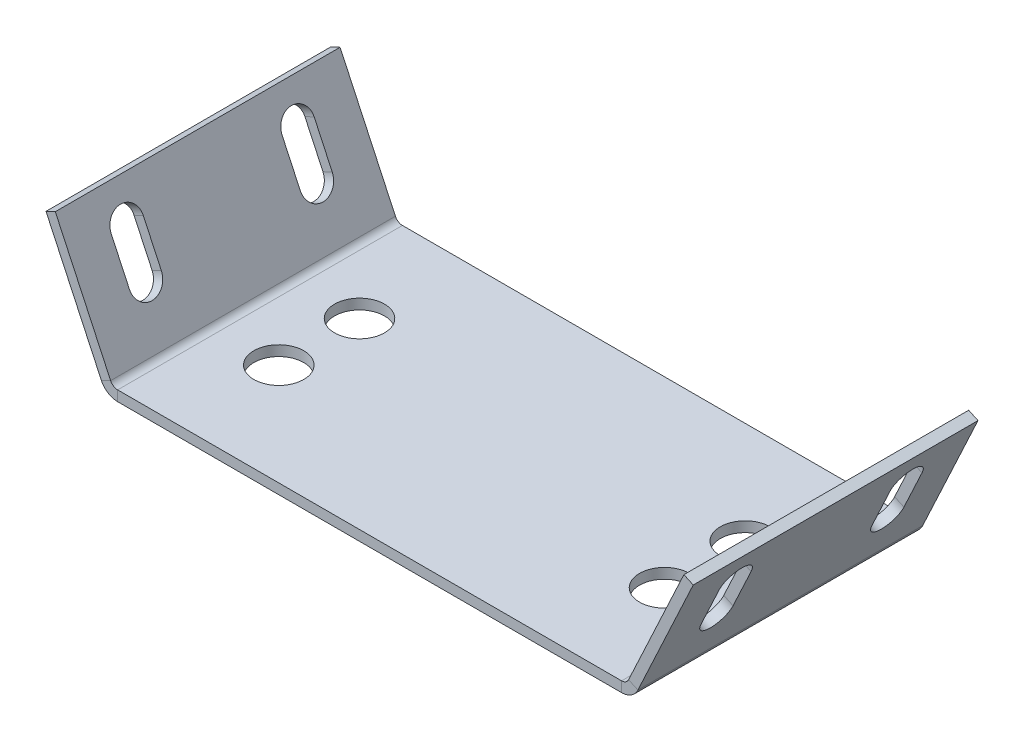
from build123d import *

# Parameters (mm, degrees)
BASE_FLANGE1_DEPTH = 31.75
CUT_EXTRUDE1_REACH = 86.256
SKETCH3_R          = 5.5626
CUT_EXTRUDE2_REACH = 137.032


# Sheet-metal steps are written as plain solids
with BuildPart() as part:
    # Sketch1 → Base-Flange1 (new, symmetric)
    with BuildSketch(Plane.XY):
        with BuildLine():
            Line((-72.15562981, 28.775272238), (-59.81800404, 2.317148392))
            ThreePointArc((-59.81800404, 2.317148392), (-58.337100418, 0.62850145), (-56.180809629, 0))
            Line((-56.180809629, 0), (56.180809629, 0))
            ThreePointArc((56.180809629, 0), (58.337100418, 0.62850145), (59.81800404, 2.317148392))
            Line((59.81800404, 2.317148392), (72.15562981, 28.775272238))
            Line((72.15562981, 28.775272238), (70.083810209, 29.741377585))
            Line((70.083810209, 29.741377585), (57.746184439, 3.283253738))
            ThreePointArc((57.746184439, 3.283253738), (57.108833513, 2.556494295), (56.180809629, 2.286))
            Line((56.180809629, 2.286), (-56.180809629, 2.286))
            ThreePointArc((-56.180809629, 2.286), (-57.108833513, 2.556494295), (-57.746184439, 3.283253738))
            Line((-57.746184439, 3.283253738), (-70.083810209, 29.741377585))
            Line((-70.083810209, 29.741377585), (-72.15562981, 28.775272238))
        make_face()
    extrude(amount=BASE_FLANGE1_DEPTH, both=True)

    # Sketch3 → Cut-Extrude1 (cut, up to next)
    with BuildSketch(Plane(origin=(0, 0, 0), x_dir=(1, 0, 0), z_dir=(0, 1, 0)), mode=Mode.PRIVATE) as cut_extrude1_sk1:
        with Locations(Location((43, 9, 0), (0, 0, 90))):
            Circle(SKETCH3_R)
    cut_extrude1_tool1 = extrude(cut_extrude1_sk1.sketch, amount=CUT_EXTRUDE1_REACH, mode=Mode.PRIVATE) & part.part
    # Sketch3 → Cut-Extrude1 (cut, up to next)
    with BuildSketch(Plane(origin=(0, 0, 0), x_dir=(1, 0, 0), z_dir=(0, 1, 0)), mode=Mode.PRIVATE) as cut_extrude1_sk2:
        with Locations(Location((43, -9, 0), (0, 0, 90))):
            Circle(SKETCH3_R)
    cut_extrude1_tool2 = extrude(cut_extrude1_sk2.sketch, amount=CUT_EXTRUDE1_REACH, mode=Mode.PRIVATE) & part.part
    # Sketch3 → Cut-Extrude1 (cut, up to next)
    with BuildSketch(Plane(origin=(0, 0, 0), x_dir=(1, 0, 0), z_dir=(0, 1, 0)), mode=Mode.PRIVATE) as cut_extrude1_sk3:
        with Locations(Location((-43, -9, 0), (0, 0, 90))):
            Circle(SKETCH3_R)
    cut_extrude1_tool3 = extrude(cut_extrude1_sk3.sketch, amount=CUT_EXTRUDE1_REACH, mode=Mode.PRIVATE) & part.part
    # Sketch3 → Cut-Extrude1 (cut, up to next)
    with BuildSketch(Plane(origin=(0, 0, 0), x_dir=(1, 0, 0), z_dir=(0, 1, 0)), mode=Mode.PRIVATE) as cut_extrude1_sk4:
        with Locations(Location((-43, 9, 0), (0, 0, 90))):
            Circle(SKETCH3_R)
    cut_extrude1_tool4 = extrude(cut_extrude1_sk4.sketch, amount=CUT_EXTRUDE1_REACH, mode=Mode.PRIVATE) & part.part
    add(cut_extrude1_tool1.solids().sort_by_distance((43, 0, -9))[0], mode=Mode.SUBTRACT)
    add(cut_extrude1_tool2.solids().sort_by_distance((43, 0, 9))[0], mode=Mode.SUBTRACT)
    add(cut_extrude1_tool3.solids().sort_by_distance((-43, 0, 9))[0], mode=Mode.SUBTRACT)
    add(cut_extrude1_tool4.solids().sort_by_distance((-43, 0, -9))[0], mode=Mode.SUBTRACT)

    # Sketch4 → Cut-Extrude2 (cut, up to next)
    with BuildSketch(Plane(origin=(48.246618612, -22.497767739, 0), x_dir=(0, 0, -1), z_dir=(0.9063077870366514, -0.4226182617406968, 0)), mode=Mode.PRIVATE) as cut_extrude2_sk1:
        with BuildLine():
            Line((22.6187, 39.098340149), (22.6187, 48.623340149))
            ThreePointArc((22.6187, 48.623340149), (19.05, 52.192040149), (15.4813, 48.623340149))
            Line((15.4813, 48.623340149), (15.4813, 39.098340149))
            ThreePointArc((15.4813, 39.098340149), (19.05, 35.529640149), (22.6187, 39.098340149))
        make_face()
    cut_extrude2_tool1 = extrude(cut_extrude2_sk1.sketch, amount=-CUT_EXTRUDE2_REACH, mode=Mode.PRIVATE) & part.part
    # Sketch4 → Cut-Extrude2 (cut, up to next)
    with BuildSketch(Plane(origin=(48.246618612, -22.497767739, 0), x_dir=(0, 0, -1), z_dir=(0.9063077870366514, -0.4226182617406968, 0)), mode=Mode.PRIVATE) as cut_extrude2_sk2:
        with BuildLine():
            Line((-15.4813, 48.623340149), (-15.4813, 39.098340149))
            ThreePointArc((-15.4813, 39.098340149), (-19.05, 35.529640149), (-22.6187, 39.098340149))
            Line((-22.6187, 39.098340149), (-22.6187, 48.623340149))
            ThreePointArc((-22.6187, 48.623340149), (-19.05, 52.192040149), (-15.4813, 48.623340149))
        make_face()
    cut_extrude2_tool2 = extrude(cut_extrude2_sk2.sketch, amount=-CUT_EXTRUDE2_REACH, mode=Mode.PRIVATE) & part.part
    cut_extrude2_1 = cut_extrude2_tool1.solids().sort_by_distance((66.783011, 17.253653, -19.05))[0]
    add(cut_extrude2_1, mode=Mode.SUBTRACT)
    cut_extrude2_2 = cut_extrude2_tool2.solids().sort_by_distance((66.783011, 17.253653, 19.05))[0]
    add(cut_extrude2_2, mode=Mode.SUBTRACT)
    cut_extrude2 = cut_extrude2_1 + cut_extrude2_2  # Cut-Extrude2 as one shape, for the pattern or mirror that repeats it

    # Mirror1: Cut-Extrude2 across plane
    add(cut_extrude2.mirror(Plane(origin=(0, 0, 0), x_dir=(0, 0, 1), z_dir=(1, 0, 0))), mode=Mode.SUBTRACT)


solid = part.part
